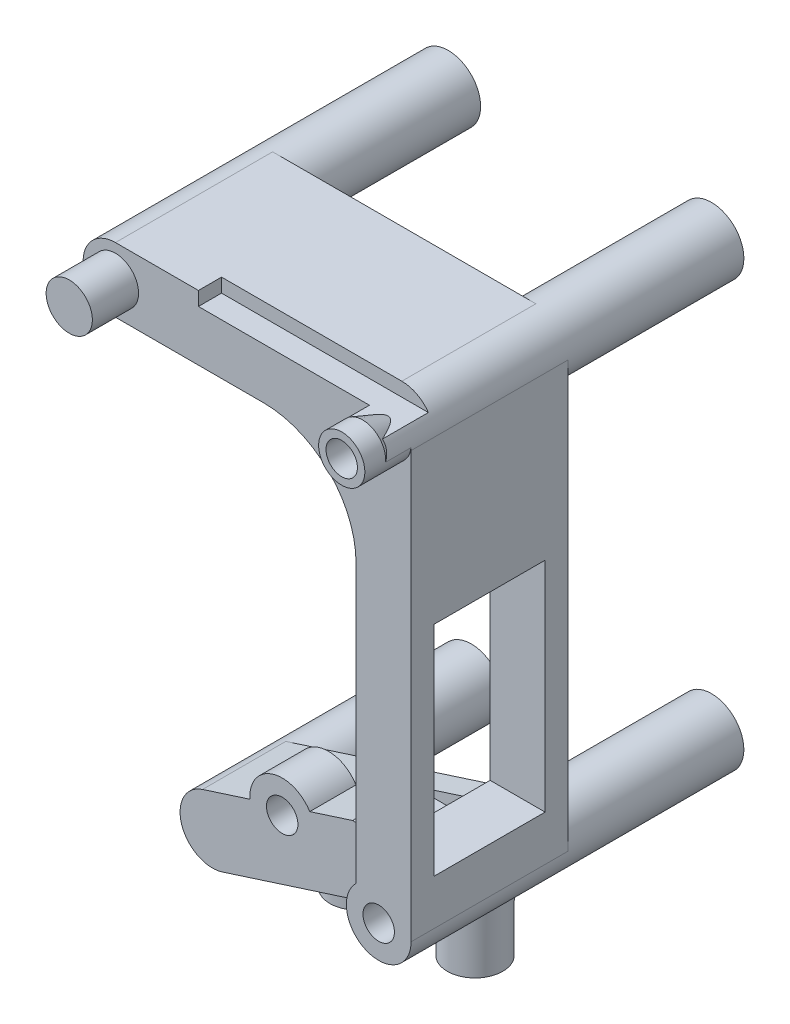
from build123d import *
from build123d.topology import SkipClean

# Parameters (mm, degrees)
SKIZZE1_R                           = 3.5
AUFSATZ_LINEAR_AUSTRAGEN1_DEPTH     = 36
AUFSATZ_LINEAR_AUSTRAGEN1_2_DEPTH   = 36
AUFSATZ_LINEAR_AUSTRAGEN1_3_DEPTH   = 36
AUFSATZ_LINEAR_AUSTRAGEN1_4_DEPTH   = 36
SKIZZE6_R                           = 2.1
SCHNITT_LINEAR_AUSTRAGEN3_DEPTH     = 5.7
AUFSATZ_LINEAR_START                = -17
AUFSATZ_LINEAR_AUSTRAGEN4_DEPTH     = 17
AUFSATZ_LINEAR_AUSTRAGEN5_DEPTH     = 17
SKIZZE9_W                           = 12
SKIZZE9_H                           = 33
SCHNITT_LINEAR_AUSTRAGEN4_DEPTH     = 104.141966
SKIZZE10_W                          = 12
SKIZZE10_H                          = 24
SCHNITT_LINEAR_AUSTRAGEN5_DEPTH     = 106.000072
SKIZZE29_W                          = 12
SKIZZE29_H                          = 0.2
AUFSATZ_LINEAR_AUSTRAGEN8_DEPTH     = 5.95
SKIZZE11_R                          = 1.7
SCHNITT_LINEAR_AUSTRAGEN6_DEPTH     = 4
VERRUNDUNG1_R                       = 10
SCHNITT_LINEAR_START                = -8
SCHNITT_LINEAR_AUSTRAGEN7_DEPTH     = 8
AUFSATZ_LINEAR_AUSTRAGEN6_REACH     = 109.145
SKIZZE15_R                          = 3
SCHNITT_LINEAR_START_2              = 55.781854
SCHNITT_LINEAR_AUSTRAGEN8_OUTLINE_W = 9
SCHNITT_LINEAR_AUSTRAGEN8_OUTLINE_H = 9
SCHNITT_LINEAR_AUSTRAGEN8_DEPTH     = 1.804361
SKIZZE18_R                          = 1.7
SCHNITT_LINEAR_AUSTRAGEN9_DEPTH     = 4
SKIZZE21_R                          = 3.5
AUFSATZ_LINEAR_AUSTRAGEN7_DEPTH     = 5
SKIZZE22_R                          = 1.7
SCHNITT_LINEAR_AUSTRAGEN10_DEPTH    = 4
SKIZZE23_R                          = 1.7
SCHNITT_LINEAR_AUSTRAGEN11_DEPTH    = 4
SKIZZE31_R                          = 2.5
AUFSATZ_LINEAR_AUSTRAGEN9_DEPTH     = 5
SKIZZE32_R                          = 1.7
SCHNITT_LINEAR_AUSTRAGEN12_DEPTH    = 4
SKIZZE33_W                          = 23
SKIZZE33_H                          = 1.5
SCHNITT_LINEAR_AUSTRAGEN13_DEPTH    = 2.5
FASE1_SIZE                          = 2.747477
FASE1_SIZE_2                        = 1


# Read off the part's stored shape, not the designer's step: Schnitt-Linear austragen8
with BuildPart() as part:
    # Skizze1 → Aufsatz-Linear austragen1 (new body)
    with BuildSketch(Plane.XY):
        with Locations(Location((-76.035534, -88.535534, 0), (0, 0, 90))):
            Circle(SKIZZE1_R)
    extrude(amount=AUFSATZ_LINEAR_AUSTRAGEN1_DEPTH)


with BuildPart() as body_2:
    # Skizze1 → Aufsatz-Linear austragen1 2 (new body)
    with BuildSketch(Plane.XY):
        with Locations(Location((-50.05, -80.201897, 0), (0, 0, 180))):
            Circle(SKIZZE1_R)
    extrude(amount=AUFSATZ_LINEAR_AUSTRAGEN1_2_DEPTH)


with BuildPart() as body_3:
    # Skizze1 → Aufsatz-Linear austragen1 3 (new body)
    with BuildSketch(Plane.XY):
        with Locations(Location((-50.05, -34.181906, 0), (0, 0, 90))):
            Circle(SKIZZE1_R)
    extrude(amount=AUFSATZ_LINEAR_AUSTRAGEN1_3_DEPTH)


with BuildPart() as body_4:
    # Skizze1 → Aufsatz-Linear austragen1 4 (new body)
    with BuildSketch(Plane.XY):
        with Locations(Location((-78.525, -34.181906, 0), (0, 0, 180))):
            Circle(SKIZZE1_R)
    extrude(amount=AUFSATZ_LINEAR_AUSTRAGEN1_4_DEPTH)


with BuildPart() as schnitt_linear_austragen3_tool:
    # Skizze6 → Schnitt-Linear austragen3 (new body)
    with BuildSketch(Plane(origin=(0, 0, 0), x_dir=(-1, 0, 0), z_dir=(0, 0, -1))):
        with Locations((50.05, -34.181906)):
            Circle(SKIZZE6_R)
        with Locations(Location((50.05, -80.201897, 0), (0, 0, 180))):
            Circle(SKIZZE6_R)
        with Locations(Location((78.525, -34.181906, 0), (0, 0, 180))):
            Circle(SKIZZE6_R)
        with Locations((76.035534, -88.535534)):
            Circle(SKIZZE6_R)
    extrude(amount=-SCHNITT_LINEAR_AUSTRAGEN3_DEPTH)


with BuildPart() as part_1:
    add(part.part)

    # Schnitt-Linear austragen3: cut by schnitt_linear_austragen3_tool
    add(schnitt_linear_austragen3_tool.part, mode=Mode.SUBTRACT)



with BuildPart() as body_2_1:
    add(body_2.part)

    # Schnitt-Linear austragen3: cut by schnitt_linear_austragen3_tool
    add(schnitt_linear_austragen3_tool.part, mode=Mode.SUBTRACT)


with BuildPart() as body_3_1:
    add(body_3.part)

    # Schnitt-Linear austragen3: cut by schnitt_linear_austragen3_tool
    add(schnitt_linear_austragen3_tool.part, mode=Mode.SUBTRACT)


with BuildPart() as body_4_1:
    add(body_4.part)

    # Schnitt-Linear austragen3: cut by schnitt_linear_austragen3_tool
    add(schnitt_linear_austragen3_tool.part, mode=Mode.SUBTRACT)


with BuildPart() as part_2:
    with SkipClean():  # the faces are left unmerged after this step: merging them gives an invalid solid
        add(part_1.part)

        add(body_2_1.part)  # Aufsatz-Linear austragen4 merges body 2

        add(body_3_1.part)  # Aufsatz-Linear austragen4 merges body 3

        add(body_4_1.part)  # Aufsatz-Linear austragen4 merges body 4
        # Skizze7 → Aufsatz-Linear austragen4 (add)
        with BuildSketch(Plane.XY.offset(36).offset(AUFSATZ_LINEAR_START)):
            with BuildLine():
                Line((-78.525, -30.681906), (-50.05, -30.681906))
                ThreePointArc((-50.05, -30.681906), (-47.575126, -31.707032), (-46.55, -34.181906))
                Line((-46.55, -34.181906), (-46.55, -80.201897))
                ThreePointArc((-46.55, -80.201897), (-47.222374, -82.264549), (-48.98116, -83.534701))
                Line((-48.98116, -83.534701), (-74.966694, -91.868338))
                ThreePointArc((-74.966694, -91.868338), (-79.368338, -89.604374), (-77.104374, -85.20273))
                Line((-77.104374, -85.20273), (-51.11884, -76.869094))
                Line((-51.11884, -76.869094), (-51.11884, -37.681906))
                Line((-51.11884, -37.681906), (-78.525, -37.681906))
                ThreePointArc((-78.525, -37.681906), (-82.025, -34.181906), (-78.525, -30.681906))
            make_face()
        extrude(amount=AUFSATZ_LINEAR_AUSTRAGEN4_DEPTH)

    # Skizze8 → Aufsatz-Linear austragen5 (add)
    with SkipClean():  # the faces are left unmerged after this step: merging them gives an invalid solid
        with BuildSketch(Plane.XY.offset(36)):
            Polygon((-51.11884, -37.681906), (-52.5, -37.681906), (-52.5, -77.312036), (-51.11884, -76.869094), align=None)
        extrude(amount=-AUFSATZ_LINEAR_AUSTRAGEN5_DEPTH)

    # Skizze9 → Schnitt-Linear austragen4 (cut, through all)
    with SkipClean():  # the faces are left unmerged after this step: merging them gives an invalid solid
        with BuildSketch(Plane.ZY.offset(52.5)):
            with Locations((27.5, -63.5)):
                Rectangle(SKIZZE9_W, SKIZZE9_H)
        extrude(amount=SCHNITT_LINEAR_AUSTRAGEN4_DEPTH, mode=Mode.SUBTRACT)

    # Skizze10 → Schnitt-Linear austragen5 (cut, through all)
    with SkipClean():  # the faces are left unmerged after this step: merging them gives an invalid solid
        with BuildSketch(Plane(origin=(-46.55, 0, 0), x_dir=(0, 0, -1), z_dir=(1, 0, 0))):
            with Locations((-27.5, -63.5)):
                Rectangle(SKIZZE10_W, SKIZZE10_H)
        extrude(amount=-SCHNITT_LINEAR_AUSTRAGEN5_DEPTH, mode=Mode.SUBTRACT)

    # Skizze29 → Aufsatz-Linear austragen8 (add)
    with SkipClean():  # the faces are left unmerged after this step: merging them gives an invalid solid
        with BuildSketch(Plane.ZY.offset(52.5)):
            with Locations((27.5, -51.6)):
                Rectangle(SKIZZE29_W, SKIZZE29_H)
            with Locations((27.5, -75.4)):
                Rectangle(SKIZZE29_W, SKIZZE29_H)
        extrude(amount=-AUFSATZ_LINEAR_AUSTRAGEN8_DEPTH)

    # Skizze11 → Schnitt-Linear austragen6 (cut)
    with SkipClean():  # the faces are left unmerged after this step: merging them gives an invalid solid
        with BuildSketch(Plane.ZY.offset(52.5)):
            with Locations(Location((31, -49.5, 0), (0, 0, 270))):
                Circle(SKIZZE11_R)
            with Locations(Location((24, -49.5, 0), (0, 0, 90))):
                Circle(SKIZZE11_R)
            with Locations(Location((24, -77.5, 0), (0, 0, 270))):
                Circle(SKIZZE11_R)
            with Locations(Location((31, -77.5, 0), (0, 0, 90))):
                Circle(SKIZZE11_R)
        extrude(amount=-SCHNITT_LINEAR_AUSTRAGEN6_DEPTH, mode=Mode.SUBTRACT)

    # Verrundung1
    verrundung1_edges = [part_2.edges().sort_by_distance(p)[0] for p in [
        (-52.5, -37.681906, 27.5),
    ]]
    fillet(verrundung1_edges, radius=VERRUNDUNG1_R)

    # Skizze13 → Schnitt-Linear austragen7 (cut)
    with SkipClean():  # the faces are left unmerged after this step: merging them gives an invalid solid
        with BuildSketch(Plane.XY.offset(36).offset(SCHNITT_LINEAR_START)):
            with BuildLine():
                Line((-52.5, -77.702397), (-52.5, -77.312036))
                Line((-52.5, -77.312036), (-77.104374, -85.20273))
                ThreePointArc((-77.104374, -85.20273), (-79.368338, -89.604374), (-74.966694, -91.868338))
                Line((-74.966694, -91.868338), (-48.98116, -83.534701))
                ThreePointArc((-48.98116, -83.534701), (-53.046805, -82.009978), (-52.5, -77.702397))
            make_face()
        extrude(amount=SCHNITT_LINEAR_AUSTRAGEN7_DEPTH, mode=Mode.SUBTRACT)

    # Aufsatz-Linear austragen6: up to this face of the body (flat: up to its plane)
    aufsatz_linear_austragen6_end = Plane(part_2.part.faces().sort_by_distance((-56.340889, -80, 25.322172))[0])
    # Skizze15 → Aufsatz-Linear austragen6 (add, up to the picked face)
    with BuildSketch(Plane(origin=(0, -89.47, 0), x_dir=(1, 0, 0), z_dir=(0, 1, 0)), mode=Mode.PRIVATE) as aufsatz_linear_austragen6_sk1:
        with Locations(Location((-63.79, -24.54, 0), (0, 0, 180))):
            Circle(SKIZZE15_R)
    aufsatz_linear_austragen6_tool1 = split(extrude(aufsatz_linear_austragen6_sk1.sketch, amount=AUFSATZ_LINEAR_AUSTRAGEN6_REACH, mode=Mode.PRIVATE), bisect_by=aufsatz_linear_austragen6_end, keep=Keep.BOTH, mode=Mode.PRIVATE)
    # Skizze15 → Aufsatz-Linear austragen6 (add, up to the picked face)
    with BuildSketch(Plane(origin=(0, -89.47, 0), x_dir=(1, 0, 0), z_dir=(0, 1, 0)), mode=Mode.PRIVATE) as aufsatz_linear_austragen6_sk2:
        with Locations(Location((-51.09, -24.54, 0), (0, 0, 90))):
            Circle(SKIZZE15_R)
    aufsatz_linear_austragen6_tool2 = split(extrude(aufsatz_linear_austragen6_sk2.sketch, amount=AUFSATZ_LINEAR_AUSTRAGEN6_REACH, mode=Mode.PRIVATE), bisect_by=aufsatz_linear_austragen6_end, keep=Keep.BOTH, mode=Mode.PRIVATE)
    add(aufsatz_linear_austragen6_tool1.solids().sort_by(Axis((-63.79, -89.47, 24.54), (0, 1, 0)))[0])
    add(aufsatz_linear_austragen6_tool2.solids().sort_by(Axis((-51.09, -89.47, 24.54), (0, 1, 0)))[0])

    # Schnitt-Linear austragen8 outline → Schnitt-Linear austragen8 (cut)
    with SkipClean():  # the faces are left unmerged after this step: merging them gives an invalid solid
        with BuildSketch(Plane(origin=(0, 0, 0), x_dir=(0.9522296605434941, 0.3053828311827991, 0), z_dir=(0.3053828311827991, -0.9522296605434941, 0)).offset(SCHNITT_LINEAR_START_2)):
            with Locations((-85.5, 24.5)):
                Rectangle(SCHNITT_LINEAR_AUSTRAGEN8_OUTLINE_W, SCHNITT_LINEAR_AUSTRAGEN8_OUTLINE_H)
        extrude(amount=SCHNITT_LINEAR_AUSTRAGEN8_DEPTH, mode=Mode.SUBTRACT)

    # Skizze18 → Schnitt-Linear austragen9 (cut)
    with SkipClean():  # the faces are left unmerged after this step: merging them gives an invalid solid
        with BuildSketch(Plane(origin=(0, -89.47, 0), x_dir=(-1, 0, 0), z_dir=(0, -1, 0))):
            with Locations(Location((63.79, -24.54, 0), (0, 0, 90))):
                Circle(SKIZZE18_R)
            with Locations(Location((51.09, -24.54, 0), (0, 0, 270))):
                Circle(SKIZZE18_R)
        extrude(amount=-SCHNITT_LINEAR_AUSTRAGEN9_DEPTH, mode=Mode.SUBTRACT)

    # Skizze21 → Aufsatz-Linear austragen7 (add)
    with SkipClean():  # the faces are left unmerged after this step: merging them gives an invalid solid
        with BuildSketch(Plane.XY.offset(28)):
            with Locations((-68.49, -83.32)):
                Circle(SKIZZE21_R)
        extrude(amount=-AUFSATZ_LINEAR_AUSTRAGEN7_DEPTH)

    # Skizze22 → Schnitt-Linear austragen10 (cut)
    with SkipClean():  # the faces are left unmerged after this step: merging them gives an invalid solid
        with BuildSketch(Plane.XY.offset(28)):
            with Locations((-68.49, -83.32)):
                Circle(SKIZZE22_R)
        extrude(amount=-SCHNITT_LINEAR_AUSTRAGEN10_DEPTH, mode=Mode.SUBTRACT)

    # Skizze23 → Schnitt-Linear austragen11 (cut)
    with SkipClean():  # the faces are left unmerged after this step: merging them gives an invalid solid
        with BuildSketch(Plane.XY.offset(36)):
            with Locations((-50.05, -80.201897)):
                Circle(SKIZZE23_R)
        extrude(amount=-SCHNITT_LINEAR_AUSTRAGEN11_DEPTH, mode=Mode.SUBTRACT)

    # Skizze31 → Aufsatz-Linear austragen9 (add)
    with SkipClean():  # the faces are left unmerged after this step: merging them gives an invalid solid
        with BuildSketch(Plane.XY.offset(36)):
            with Locations(Location((-49.05, -33.681906, 0), (0, 0, 180))):
                Circle(SKIZZE31_R)
            with Locations(Location((-78.525, -34.181906, 0), (0, 0, 180))):
                Circle(SKIZZE31_R)
        extrude(amount=AUFSATZ_LINEAR_AUSTRAGEN9_DEPTH)

    # Skizze32 → Schnitt-Linear austragen12 (cut)
    with SkipClean():  # the faces are left unmerged after this step: merging them gives an invalid solid
        with BuildSketch(Plane.XY.offset(41)):
            with Locations((-49.05, -33.681906)):
                Circle(SKIZZE32_R)
        extrude(amount=-SCHNITT_LINEAR_AUSTRAGEN12_DEPTH, mode=Mode.SUBTRACT)

    # Skizze33 → Schnitt-Linear austragen13 (cut)
    with SkipClean():  # the faces are left unmerged after this step: merging them gives an invalid solid
        with BuildSketch(Plane.XY.offset(36)):
            with Locations((-58.05, -31.431906)):
                Rectangle(SKIZZE33_W, SKIZZE33_H)
        extrude(amount=-SCHNITT_LINEAR_AUSTRAGEN13_DEPTH, mode=Mode.SUBTRACT)

    # Fase1
    # the kernel refuses this chamfer: 2.747477, 1 mm, written as the material it takes off along each edge
    with BuildSketch(Plane(origin=(-49.05, -33.681906, 36), x_dir=(0.5242034775498527, 0.8515930449015192, 0), z_dir=(0.8515930449015192, -0.5242034775498527, 0))) as fase1_piece_1_section:
        Polygon((2.5, FASE1_SIZE), (2.5 - FASE1_SIZE_2, 0), (2.5, 0), align=None)
    fase1_piece_1 = revolve(axis=Axis((-49.05, -33.681906, 36), (0, 0, 1)), revolution_arc=248.152989, mode=Mode.PRIVATE)
    fase1_piece_1 = split(fase1_piece_1, bisect_by=Plane(origin=(-49.325662, -32.181906, 36.981641), z_dir=(0, 1, 0)), keep=Keep.TOP, mode=Mode.PRIVATE)
    add(fase1_piece_1, mode=Mode.SUBTRACT)
    with BuildSketch(Plane(origin=(-49.05, -33.681906, 36), x_dir=(0.7999999999998098, 0.6000000000002538, 0), z_dir=(0.6000000000002538, -0.7999999999998098, 0))) as fase1_piece_2_section:
        Polygon((2.5, FASE1_SIZE), (2.5 - FASE1_SIZE_2, 0), (2.5, 0), align=None)
    fase1_piece_2 = revolve(axis=Axis((-49.05, -33.681906, 36), (0, 0, 1)), revolution_arc=21.515465, mode=Mode.PRIVATE)
    fase1_piece_2 = split(fase1_piece_2, bisect_by=Plane(origin=(-47.319957, -32.181906, 37.325134), z_dir=(0, 1, 0)), keep=Keep.TOP, mode=Mode.PRIVATE)
    add(fase1_piece_2, mode=Mode.SUBTRACT)
    with BuildSketch(Plane(origin=(-49.05, -33.681906, 36), x_dir=(0.7999999999998098, 0.6000000000002538, 0), z_dir=(0.6000000000002538, -0.7999999999998098, 0))) as fase1_piece_3_section:
        Polygon((2.5, FASE1_SIZE), (2.5 - FASE1_SIZE_2, 0), (2.5, 0), align=None)
    fase1_piece_3 = revolve(axis=Axis((-49.05, -33.681906, 36), (0, 0, 1)), revolution_arc=21.515465, mode=Mode.PRIVATE)
    fase1_piece_3 = fase1_piece_3 - Plane(origin=(-50.05, -34.181906, 37.279822), x_dir=(0, 1, 0), z_dir=(0, 0, -1)) * Cylinder(3.5, 11, mode=Mode.PRIVATE)
    add(fase1_piece_3, mode=Mode.SUBTRACT)
    with BuildSketch(Plane(origin=(-49.05, -33.681906, 36), x_dir=(-0.9803390922069691, -0.1973202075075323, 0), z_dir=(-0.1973202075075323, 0.9803390922069691, 0))) as fase1_piece_4_section:
        Polygon((2.5 - FASE1_SIZE_2, 0), (2.5, FASE1_SIZE), (2.5, 0), align=None)
    fase1_piece_4 = revolve(axis=Axis((-49.05, -33.681906, 36), (0, 0, 1)), revolution_arc=205.489602, mode=Mode.PRIVATE)
    fase1_piece_4 = fase1_piece_4 - Plane(origin=(-50.05, -34.181906, 37.306598), x_dir=(0, 1, 0), z_dir=(0, 0, -1)) * Cylinder(3.5, 11, mode=Mode.PRIVATE)
    add(fase1_piece_4, mode=Mode.SUBTRACT)


solid = part_2.part
